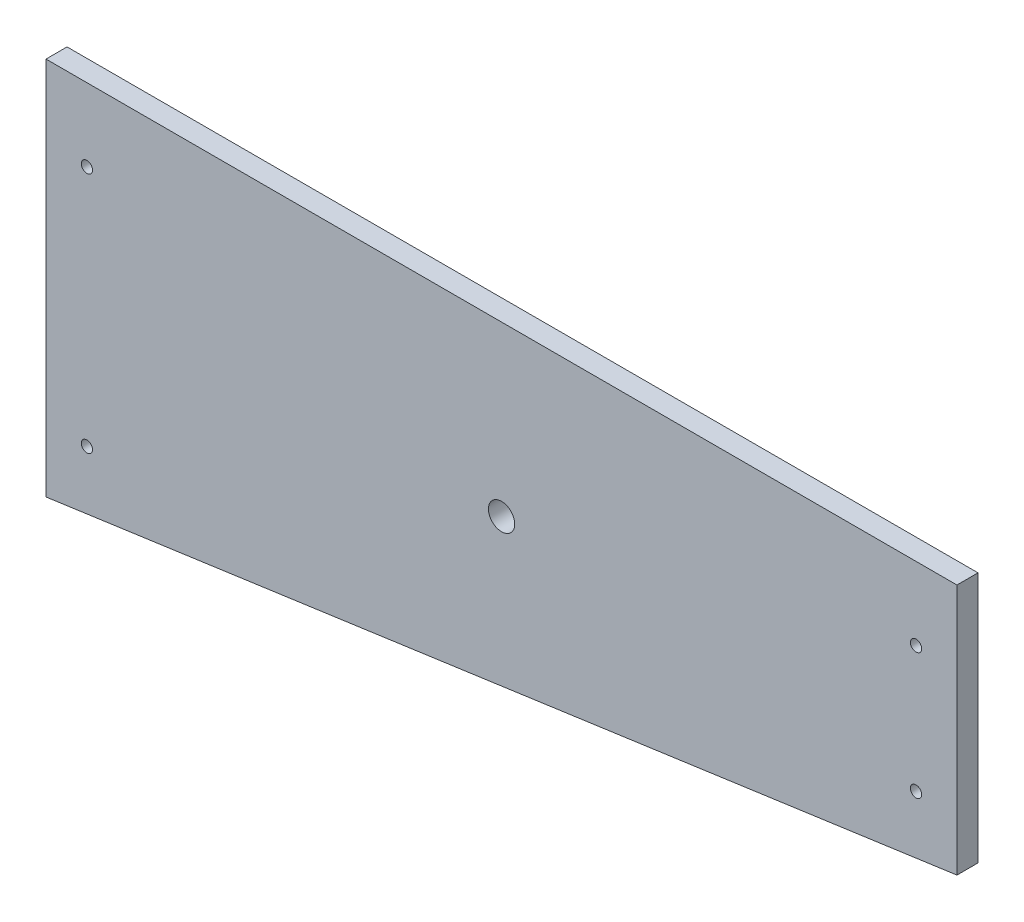
from build123d import *

# Parameters (mm, degrees)
SKETCH1_W            = 274.7772
SKETCH1_H            = 114.4016
BOSS_EXTRUDE1_DEPTH  = 6.35
M3_CLEARANCE_HOLE1_D = 3.4
CUT_EXTRUDE2_DEPTH   = 298.708848075
SKETCH6_R            = 3.96875
DIAPHRAGM_DEPTH      = 298.708848075


with BuildPart() as part:
    # Sketch1 → Boss-Extrude1 (new body)
    with BuildSketch(Plane.XY):
        with Locations((137.3886, 57.2008)):
            Rectangle(SKETCH1_W, SKETCH1_H)
    extrude(amount=BOSS_EXTRUDE1_DEPTH)

    # M3 Clearance Hole1 (through all)
    with Locations(Plane.XY.offset(6.35)):
        with Locations((12.3444, 92.4052), (12.3444, 19.3802), (262.4328, 54.3052), (262.4328, 92.4052)):
            Hole(M3_CLEARANCE_HOLE1_D / 2)

    # Sketch5 → Cut-Extrude2 (cut, through all)
    with BuildSketch(Plane.XY.offset(6.35)):
        Polygon((0, 0), (274.7772, 0), (274.7772, 38.617417045), align=None)
    extrude(amount=-CUT_EXTRUDE2_DEPTH, mode=Mode.SUBTRACT)

    # Sketch6 → diaphragm (cut, through all)
    with BuildSketch(Plane.XY.offset(6.35)):
        with Locations((137.414, 63.6016)):
            Circle(SKETCH6_R)
    extrude(amount=-DIAPHRAGM_DEPTH, mode=Mode.SUBTRACT)


solid = part.part
